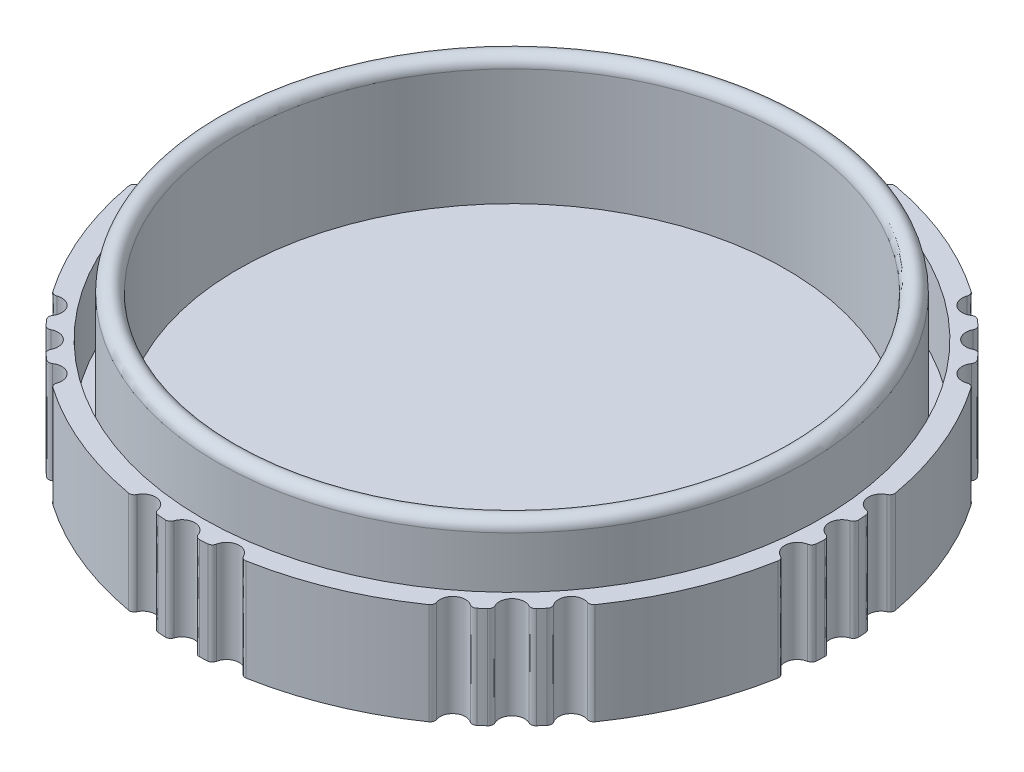
from build123d import *

# Parameters (mm, degrees)
SKETCH8_R           = 58
BOSS_EXTRUDE3_DEPTH = 10
SKETCH9_R           = 65
BOSS_EXTRUDE4_DEPTH = 20
SKETCH10_R          = 54
CUT_EXTRUDE3_DEPTH  = 25
CUT_EXTRUDE4_START  = -15
SKETCH11_R          = 61
SKETCH11_R_2        = 58
CUT_EXTRUDE4_DEPTH  = 15
SKETCH12_R          = 2.5
CUT_EXTRUDE6_DEPTH  = 30
VARFILLET2_R        = 1
FILLET3_R           = 2


with BuildPart() as part:
    # Sketch8 → Boss-Extrude3 (new body)
    with BuildSketch(Plane(origin=(0, 0, 0), x_dir=(1, 0, 0), z_dir=(0, 1, 0))):
        with Locations(Location((0, 0, 0), (0, 0, 270))):
            Circle(SKETCH8_R)
    extrude(amount=BOSS_EXTRUDE3_DEPTH)

    # Sketch9 → Boss-Extrude4 (add)
    with BuildSketch(Plane(origin=(0, 0, 0), x_dir=(1, 0, 0), z_dir=(0, 1, 0))):
        with Locations(Location((0, 0, 0), (0, 0, 270))):
            Circle(SKETCH9_R)
    extrude(amount=-BOSS_EXTRUDE4_DEPTH)

    # Sketch10 → Cut-Extrude3 (cut)
    with BuildSketch(Plane(origin=(0, 10, 0), x_dir=(1, 0, 0), z_dir=(0, 1, 0))):
        with Locations(Location((0, 0, 0), (0, 0, 270))):
            Circle(SKETCH10_R)
    extrude(amount=-CUT_EXTRUDE3_DEPTH, mode=Mode.SUBTRACT)

    # Sketch11 → Cut-Extrude4 (cut)
    with BuildSketch(Plane(origin=(0, 0, 0), x_dir=(1, 0, 0), z_dir=(0, 1, 0)).offset(CUT_EXTRUDE4_START)):
        with Locations(Location((0, 0, 0), (0, 0, 270))):
            Circle(SKETCH11_R)
        with Locations(Location((0, 0, 0), (0, 0, 270))):
            Circle(SKETCH11_R_2, mode=Mode.SUBTRACT)
    extrude(amount=CUT_EXTRUDE4_DEPTH, mode=Mode.SUBTRACT)

    # Sketch12 → Cut-Extrude6 (cut)
    with BuildSketch(Plane.XZ.offset(20)):
        with Locations((65, 0)):
            Circle(SKETCH12_R)
        with Locations((64.473668484, -8.255063426)):
            Circle(SKETCH12_R)
        with Locations((64.473668484, 8.255063426)):
            Circle(SKETCH12_R)
        with Locations((51.426979521, -39.752556866)):
            Circle(SKETCH12_R)
        with Locations((45.961940777, -45.961940777)):
            Circle(SKETCH12_R)
        with Locations((39.752556866, -51.426979521)):
            Circle(SKETCH12_R)
        with Locations((8.255063426, -64.473668484)):
            Circle(SKETCH12_R)
        with Locations((0, -65)):
            Circle(SKETCH12_R)
        with Locations((-8.255063426, -64.473668484)):
            Circle(SKETCH12_R)
        with Locations((-39.752556866, -51.426979521)):
            Circle(SKETCH12_R)
        with Locations((-45.961940777, -45.961940777)):
            Circle(SKETCH12_R)
        with Locations((-51.426979521, -39.752556866)):
            Circle(SKETCH12_R)
        with Locations((-64.473668484, -8.255063426)):
            Circle(SKETCH12_R)
        with Locations((-65, 0)):
            Circle(SKETCH12_R)
        with Locations((-64.473668484, 8.255063426)):
            Circle(SKETCH12_R)
        with Locations((-51.426979521, 39.752556866)):
            Circle(SKETCH12_R)
        with Locations((-45.961940777, 45.961940777)):
            Circle(SKETCH12_R)
        with Locations((-39.752556866, 51.426979521)):
            Circle(SKETCH12_R)
        with Locations((-8.255063426, 64.473668484)):
            Circle(SKETCH12_R)
        with Locations((0, 65)):
            Circle(SKETCH12_R)
        with Locations((8.255063426, 64.473668484)):
            Circle(SKETCH12_R)
        with Locations((39.752556866, 51.426979521)):
            Circle(SKETCH12_R)
        with Locations((45.961940777, 45.961940777)):
            Circle(SKETCH12_R)
        with Locations((51.426979521, 39.752556866)):
            Circle(SKETCH12_R)
    extrude(amount=-CUT_EXTRUDE6_DEPTH, mode=Mode.SUBTRACT)

    # VarFillet2
    varfillet2_edges = [part.edges().sort_by_distance(p)[0] for p in [
        (-47.695385302, -10, -44.160505216),
        (-44.160505216, -10, -47.695385302),
        (-52.917603564, -10, -37.745559117),
        (-49.860280064, -10, -41.700749057),
        (-64.743424584, -10, -5.769659707),
        (-64.108537136, -10, -10.728255512),
        (-64.951923077, -10, 2.499537679),
        (-64.951923077, -10, -2.499537679),
        (-64.108537136, -10, 10.728255512),
        (-64.743424584, -10, 5.769659707),
        (-49.860280064, -10, 41.700749057),
        (-52.917603564, -10, 37.745559117),
        (-44.160505216, -10, 47.695385302),
        (-47.695385302, -10, 44.160505216),
        (-37.745559117, -10, 52.917603564),
        (-41.700749057, -10, 49.860280064),
        (-5.769659707, -10, 64.743424584),
        (-10.728255512, -10, 64.108537136),
        (2.499537679, -10, 64.951923077),
        (-2.499537679, -10, 64.951923077),
        (10.728255512, -10, 64.108537136),
        (5.769659707, -10, 64.743424584),
        (41.700749057, -10, 49.860280064),
        (37.745559117, -10, 52.917603564),
        (47.695385302, -10, 44.160505216),
        (44.160505216, -10, 47.695385302),
        (52.917603564, -10, 37.745559117),
        (49.860280064, -10, 41.700749057),
        (64.743424584, -10, 5.769659707),
        (64.108537136, -10, 10.728255512),
        (64.951923077, -10, -2.499537679),
        (64.951923077, -10, 2.499537679),
        (64.108537136, -10, -10.728255512),
        (64.743424584, -10, -5.769659707),
        (-41.700749057, -10, -49.860280064),
        (-37.745559117, -10, -52.917603564),
        (49.860280064, -10, -41.700749057),
        (52.917603564, -10, -37.745559117),
        (44.160505216, -10, -47.695385302),
        (47.695385302, -10, -44.160505216),
        (37.745559117, -10, -52.917603564),
        (41.700749057, -10, -49.860280064),
        (5.769659707, -10, -64.743424584),
        (10.728255512, -10, -64.108537136),
        (-2.499537679, -10, -64.951923077),
        (2.499537679, -10, -64.951923077),
        (-10.728255512, -10, -64.108537136),
        (-5.769659707, -10, -64.743424584),
    ]]
    fillet(varfillet2_edges, radius=VARFILLET2_R)

    # Fillet3
    fillet3_edges = [part.edges().sort_by_distance(p)[0] for p in [
        (0, 10, -54),
        (0, 10, -58),
    ]]
    fillet(fillet3_edges, radius=FILLET3_R - 0.0001)  # a hair under: the kernel refuses the full size


solid = part.part
